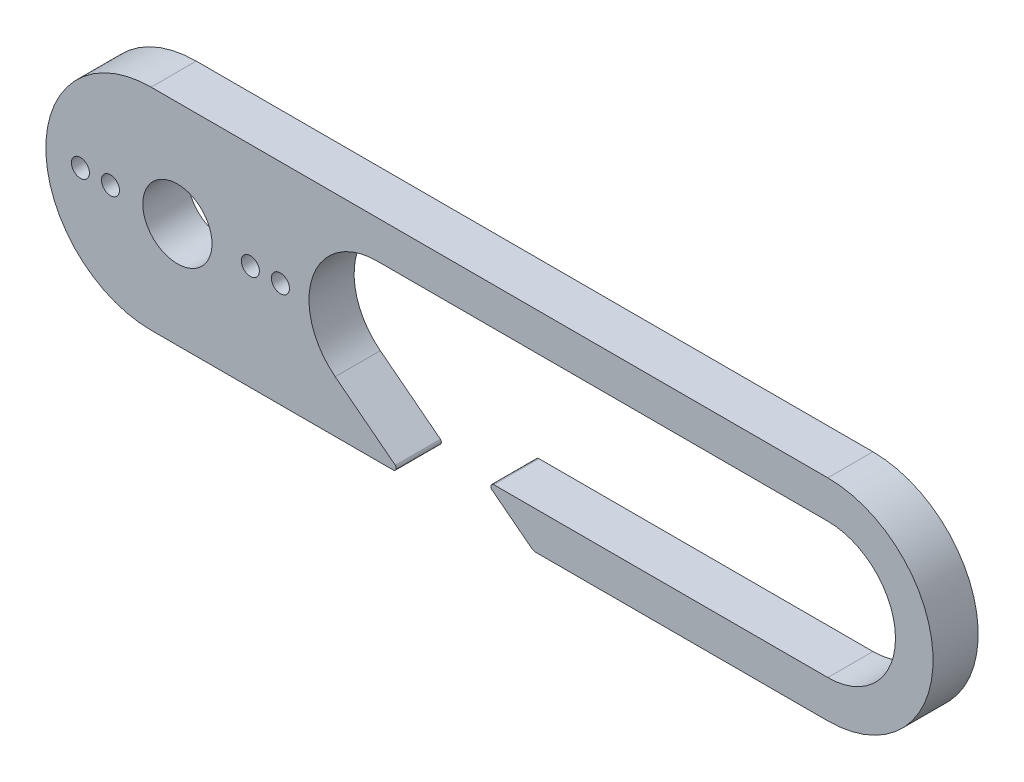
from build123d import *

# Parameters (mm, degrees)
SKETCH2_R           = 0.6
SKETCH2_R_2         = 2.3
BOSS_EXTRUDE1_DEPTH = 3


with BuildPart() as part:
    # Sketch2 → Boss-Extrude1 (new body)
    with BuildSketch(Plane.XY):
        with BuildLine():
            Line((16.770369268, 4.5), (46.770369268, 4.5))
            ThreePointArc((46.770369268, 4.5), (51.270370099, 0), (46.770369268, -4.5))
            Line((46.770369268, -4.5), (24.560820229, -4.5))
            ThreePointArc((24.560820229, -4.5), (24.371598614, -4.635229787), (24.438260986, -4.858048195))
            Line((24.438260986, -4.858048195), (27.065199516, -6.895120487))
            ThreePointArc((27.065199516, -6.895120487), (27.209672091, -6.973054037), (27.371597624, -7))
            Line((27.371597624, -7), (46.770368806, -7))
            ThreePointArc((46.770368806, -7), (53.770370099, -2.31e-07), (46.770369268, 7))
            Line((46.770369268, 7), (1.770370099, 7))
            ThreePointArc((1.770370099, 7), (-5.229629901, 0), (1.770370099, -7))
            Line((1.770370099, -7), (17.871597624, -7))
            ThreePointArc((17.871597624, -7), (18.057004855, -6.874994391), (18.010642647, -6.656241586))
            Line((18.010642647, -6.656241586), (14.012786293, -3.556084383))
            ThreePointArc((14.012786293, -3.556084383), (12.512882937, 1.457329797), (16.770369268, 4.5))
        make_face()
        with Locations((-2.929630317, 0)):
            Circle(SKETCH2_R, mode=Mode.SUBTRACT)
        with Locations((-0.929630317, 0)):
            Circle(SKETCH2_R, mode=Mode.SUBTRACT)
        with Locations((3.520369683, 0)):
            Circle(SKETCH2_R_2, mode=Mode.SUBTRACT)
        with Locations((8.370369683, 0)):
            Circle(SKETCH2_R, mode=Mode.SUBTRACT)
        with Locations((10.370369683, 0)):
            Circle(SKETCH2_R, mode=Mode.SUBTRACT)
    extrude(amount=BOSS_EXTRUDE1_DEPTH)


solid = part.part
